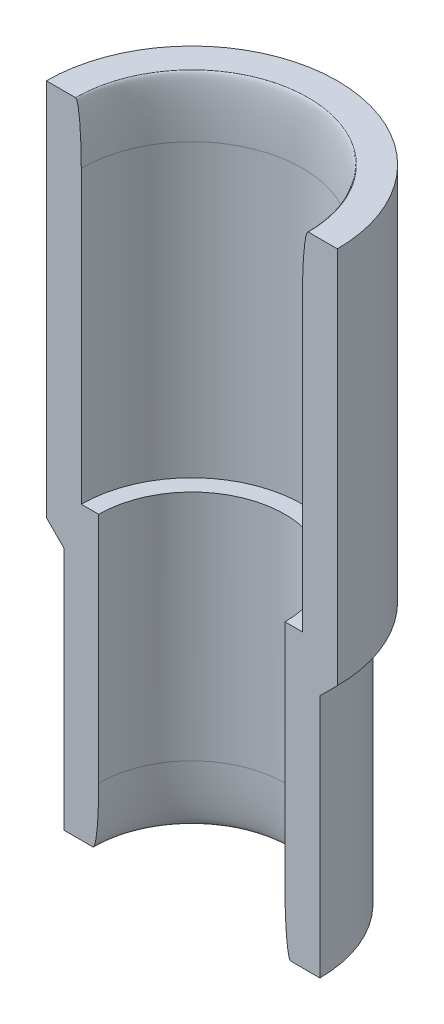
from build123d import *

# Parameters (mm, degrees)
SKETCH_1_R          = 11
SKETCH_1_R_2        = 8
EXTRUDE_1_DEPTH     = 25
SKETCH_2_R          = 12.5
SKETCH_2_R_2        = 9.5
EXTRUDE_2_DEPTH     = 30
CHAMFER_2_SIZE      = 4
FILLET_1_SIZE       = 0.5
FILLET_1_SIZE_2     = 5
FILLET_2_SIZE       = 0.5
FILLET_2_SIZE_2     = 5
SKETCH_3_W          = 25
SKETCH_3_H          = 12.5
CUT_EXTRUDE_2_DEPTH = 58.771100137


with BuildPart() as part:
    # 草图1 → 凸台-拉伸1 (new body)
    with BuildSketch(Plane(origin=(0, 0, 0), x_dir=(1, 0, 0), z_dir=(0, 1, 0))):
        with Locations(Location((0, 0, 0), (0, 0, 270))):
            Circle(SKETCH_1_R)
        with Locations(Location((0, 0, 0), (0, 0, 270))):
            Circle(SKETCH_1_R_2, mode=Mode.SUBTRACT)
    extrude(amount=EXTRUDE_1_DEPTH)

    # 草图2 → 凸台-拉伸2 (add)
    with BuildSketch(Plane(origin=(0, 25, 0), x_dir=(1, 0, 0), z_dir=(0, 1, 0))):
        with Locations(Location((0, 0, 0), (0, 0, 270))):
            Circle(SKETCH_2_R)
        with Locations(Location((0, 0, 0), (0, 0, 270))):
            Circle(SKETCH_2_R_2, mode=Mode.SUBTRACT)
    extrude(amount=EXTRUDE_2_DEPTH)

    # 倒角2
    # the kernel refuses this chamfer: 4 mm, written as the material it adds along each edge
    with BuildSketch(Plane(origin=(0, 25, 0), x_dir=(0, 0, 1), z_dir=(-1, 0, 0))) as chamfer_2_piece_1_section:
        Polygon((11, -CHAMFER_2_SIZE), (11 + CHAMFER_2_SIZE, 0), (11, 0), align=None)
    chamfer_2_piece_1 = revolve(axis=Axis((0, 25, 0), (0, 1, 0)), mode=Mode.PRIVATE)
    chamfer_2_piece_1 = chamfer_2_piece_1 & Plane(origin=(0, 21.745250117, 0), x_dir=(0, 0, 1), z_dir=(0, -1, 0)) * Cylinder(12.5, 60, mode=Mode.PRIVATE)
    add(chamfer_2_piece_1)

    # 圆角1
    # an asymmetric fillet: 5, 0.5 mm, written as the material it takes off along each edge
    with BuildSketch(Plane(origin=(0, 0, 0), x_dir=(0, 0, 1), z_dir=(-1, 0, 0))) as fillet_1_piece_1:
        with BuildLine():
            Bezier((8 + FILLET_1_SIZE, 0), (8, 0), (8, FILLET_1_SIZE_2), weights=[1, 0.707106781, 1])
            Line((8, FILLET_1_SIZE_2), (8, 0))
            Line((8, 0), (8 + FILLET_1_SIZE, 0))
        make_face()
    revolve(axis=Axis((0, 0, 0), (0, 1, 0)), mode=Mode.SUBTRACT)

    # 圆角2
    # an asymmetric fillet: 5, 0.5 mm, written as the material it takes off along each edge
    with BuildSketch(Plane(origin=(0, 55, 0), x_dir=(0, 0, 1), z_dir=(-1, 0, 0))) as fillet_2_piece_1:
        with BuildLine():
            Bezier((9.5 + FILLET_2_SIZE, 0), (9.5, 0), (9.5, -FILLET_2_SIZE_2), weights=[1, 0.707106781, 1])
            Line((9.5, -FILLET_2_SIZE_2), (9.5, 0))
            Line((9.5, 0), (9.5 + FILLET_2_SIZE, 0))
        make_face()
    revolve(axis=Axis((0, 55, 0), (0, 1, 0)), mode=Mode.SUBTRACT)

    # 草图3 → 切除-拉伸2 (cut, through all)
    with BuildSketch(Plane(origin=(0, 55, 0), x_dir=(1, 0, 0), z_dir=(0, 1, 0))):
        with Locations((0, -6.25)):
            Rectangle(SKETCH_3_W, SKETCH_3_H)
    extrude(amount=-CUT_EXTRUDE_2_DEPTH, mode=Mode.SUBTRACT)


solid = part.part
